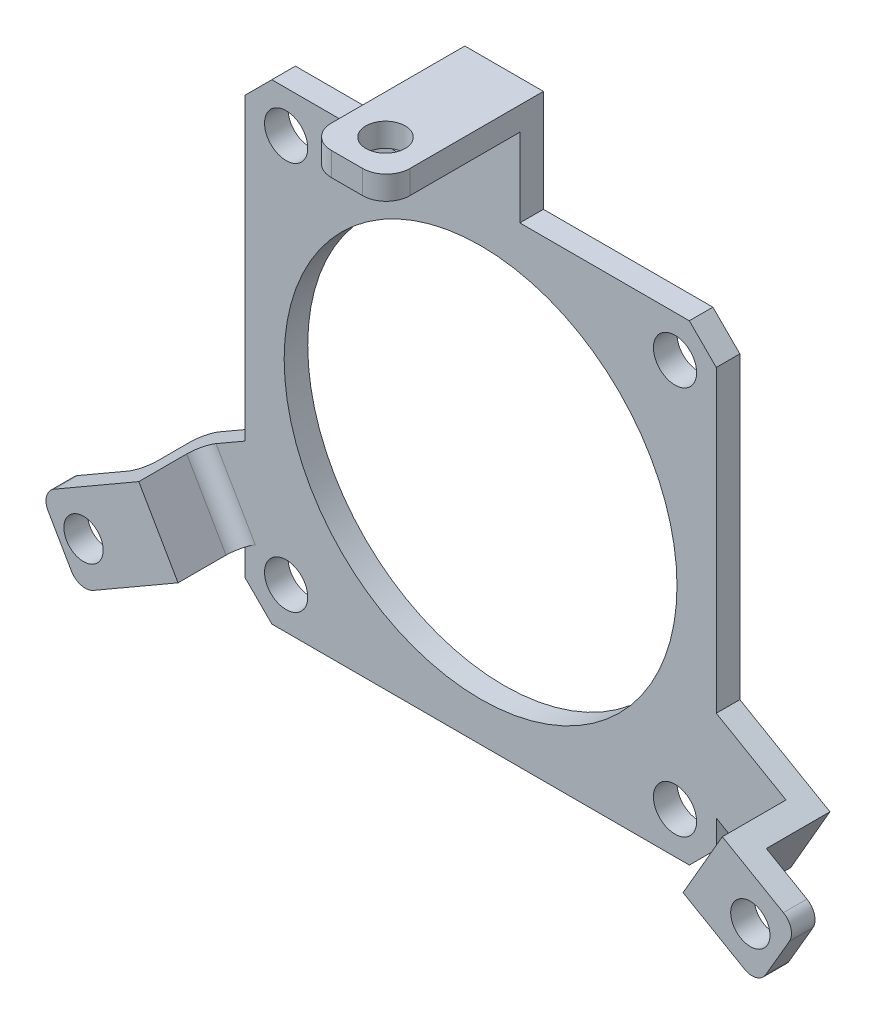
from build123d import *

# Parameters (mm, degrees)
SKETCH1_R           = 2.75
SKETCH1_R_2         = 25
SKETCH1_W           = 10
SKETCH1_H           = 11
SKETCH1_H_2         = 2
BOSS_EXTRUDE1_DEPTH = 2
SKETCH5_W           = 10
SKETCH5_H           = 3
BOSS_EXTRUDE2_DEPTH = 9.1
BOSS_EXTRUDE5_DEPTH = 3
SKETCH5_2_W         = 10
SKETCH5_2_H         = 3
BOSS_EXTRUDE6_DEPTH = 18
SKETCH7_R           = 2.5
CUT_EXTRUDE1_DEPTH  = 10
SKETCH1_4_R         = 2.75
SKETCH1_4_R_2       = 25
BOSS_EXTRUDE7_DEPTH = 3
SKETCH1_5_W         = 10
SKETCH1_5_H         = 11
BOSS_EXTRUDE8_DEPTH = 3
FILLET5_R           = 2
SKETCH10_R          = 2.5
CUT_EXTRUDE2_DEPTH  = 4
FILLET6_R           = 3
FILLET7_START       = -5
FILLET7_DEPTH       = 10
FILLET7_2_DEPTH     = 10


with BuildPart() as part:
    # Sketch1 → Boss-Extrude1 (new body)
    # profile 1 of 7: a face of its own
    with BuildSketch(Plane.XY):
        Polygon((26.568542495, 30), (-26.568542495, 30), (-30, 26.568542495), (-30, -26.568542495), (-26.568542495, -30), (26.568542495, -30), (30, -26.568542495), (30, 26.568542495), align=None)
        with Locations((-24.748737342, -24.748737342)):
            Circle(SKETCH1_R, mode=Mode.SUBTRACT)
        with Locations((24.748737342, -24.748737342)):
            Circle(SKETCH1_R, mode=Mode.SUBTRACT)
        with Locations((24.748737342, 24.748737342)):
            Circle(SKETCH1_R, mode=Mode.SUBTRACT)
        with Locations((-24.748737342, 24.748737342)):
            Circle(SKETCH1_R, mode=Mode.SUBTRACT)
        Circle(SKETCH1_R_2, mode=Mode.SUBTRACT)
    # profile 2 of 7: a face of its own
    with BuildSketch(Plane.XY):
        Polygon((-30, -23.094010768), (-30, -11.547005384), (-36.267949192, -15.165807537), (-31.267949192, -23.826061575), align=None)
    # profile 3 of 7: a face of its own
    with BuildSketch(Plane.XY):
        with Locations((0, 35.5)):
            Rectangle(SKETCH1_W, SKETCH1_H)
    # profile 4 of 7: a face of its own
    with BuildSketch(Plane.XY):
        Polygon((39.739092363, -17.169872981), (30, -11.547005384), (30, -23.094010768), (34.739092363, -25.830127019), align=None)
    # profile 5 of 7: a face of its own
    with BuildSketch(Plane.XY):
        Polygon((41.47114317, -18.169872981), (39.739092363, -17.169872981), (34.739092363, -25.830127019), (36.47114317, -26.830127019), align=None)
    # profile 6 of 7: a face of its own
    with BuildSketch(Plane.XY):
        with Locations((0, 42)):
            Rectangle(SKETCH1_W, SKETCH1_H_2)
    # profile 7 of 7: a face of its own
    with BuildSketch(Plane.XY):
        Polygon((-31.267949192, -23.826061575), (-36.267949192, -15.165807537), (-38, -16.165807537), (-33, -24.826061575), align=None)
    extrude(amount=BOSS_EXTRUDE1_DEPTH)

    # Sketch5 → Boss-Extrude2 (add)
    with BuildSketch(Plane.XY.offset(2)):
        with Locations((0, 41.5)):
            Rectangle(SKETCH5_W, SKETCH5_H)
        Polygon((-38, -16.165807537), (-35.401923789, -14.665807537), (-30.401923789, -23.326061575), (-33, -24.826061575), align=None)
        Polygon((41.47114317, -18.169872981), (38.873066959, -16.669872981), (33.873066959, -25.330127019), (36.47114317, -26.830127019), align=None)
    extrude(amount=BOSS_EXTRUDE2_DEPTH)

    # Sketch6 → Boss-Extrude5 (add)
    with BuildSketch(Plane.XY.offset(11.1)):
        with BuildLine():
            Line((-46.185292351, -20.891588279), (-35.401923789, -14.665807537))
            Line((-35.401923789, -14.665807537), (-30.401923789, -23.326061575))
            Line((-30.401923789, -23.326061575), (-41.185292351, -29.551842317))
            ThreePointArc((-41.185292351, -29.551842317), (-42.739686509, -29.75648219), (-43.983511401, -28.802061782))
            Line((-43.983511401, -28.802061782), (-46.935072886, -23.68980733))
            ThreePointArc((-46.935072886, -23.68980733), (-47.139712759, -22.135413172), (-46.185292351, -20.891588279))
        make_face()
        with BuildLine():
            Line((38.897920412, -16.684222129), (33.873066959, -25.330127019))
            Line((33.873066959, -25.330127019), (41.664082648, -29.84192454))
            ThreePointArc((41.664082648, -29.84192454), (43.179952831, -30.044118571), (44.395530273, -29.116155036))
            Line((44.395530273, -29.116155036), (47.391974814, -23.960387856))
            ThreePointArc((47.391974814, -23.960387856), (47.600320032, -22.403746576), (46.645140907, -21.157081967))
            Line((46.645140907, -21.157081967), (38.897920412, -16.684222129))
        make_face()
    extrude(amount=-BOSS_EXTRUDE5_DEPTH)

    # Sketch5<2> → Boss-Extrude6 (add)
    with BuildSketch(Plane.XY.offset(2)):
        with Locations((0, 41.5)):
            Rectangle(SKETCH5_2_W, SKETCH5_2_H)
    extrude(amount=BOSS_EXTRUDE6_DEPTH)

    # Sketch7 → Cut-Extrude1 (cut)
    with BuildSketch(Plane(origin=(0, 43, 0), x_dir=(1, 0, 0), z_dir=(0, 1, 0))):
        with Locations(Location((0, -15.1, 0), (0, 0, 270))):
            Circle(SKETCH7_R)
    extrude(amount=-CUT_EXTRUDE1_DEPTH, mode=Mode.SUBTRACT)

    # Sketch1<4> → Boss-Extrude7 (add)
    with BuildSketch(Plane.XY):
        Polygon((26.568542495, 30), (-26.568542495, 30), (-30, 26.568542495), (-30, -26.568542495), (-26.568542495, -30), (26.568542495, -30), (30, -26.568542495), (30, 26.568542495), align=None)
        with Locations((-24.748737342, -24.748737342)):
            Circle(SKETCH1_4_R, mode=Mode.SUBTRACT)
        with Locations((24.748737342, -24.748737342)):
            Circle(SKETCH1_4_R, mode=Mode.SUBTRACT)
        with Locations((24.748737342, 24.748737342)):
            Circle(SKETCH1_4_R, mode=Mode.SUBTRACT)
        with Locations((-24.748737342, 24.748737342)):
            Circle(SKETCH1_4_R, mode=Mode.SUBTRACT)
        Circle(SKETCH1_4_R_2, mode=Mode.SUBTRACT)
    extrude(amount=BOSS_EXTRUDE7_DEPTH)

    # Sketch1<5> → Boss-Extrude8 (add)
    with BuildSketch(Plane.XY):
        with Locations((0, 35.5)):
            Rectangle(SKETCH1_5_W, SKETCH1_5_H)
        Polygon((-30, -23.094010768), (-30, -11.547005384), (-36.267949192, -15.165807537), (-31.267949192, -23.826061575), align=None)
        Polygon((39.739092363, -17.169872981), (30, -11.547005384), (30, -23.094010768), (34.739092363, -25.830127019), align=None)
    extrude(amount=BOSS_EXTRUDE8_DEPTH)

    # Fillet5
    fillet5_edges = [part.edges().sort_by_distance(p)[0] for p in [
        (-35.5, -20.495934556, 8.1),
    ]]
    fillet(fillet5_edges, radius=FILLET5_R)

    # Sketch10 → Cut-Extrude2 (cut)
    with BuildSketch(Plane.XY.offset(11.1)):
        with Locations((42.435244785, -24.5)):
            Circle(SKETCH10_R)
        with Locations((-42.435244785, -24.5)):
            Circle(SKETCH10_R)
    extrude(amount=-CUT_EXTRUDE2_DEPTH, mode=Mode.SUBTRACT)

    # Fillet6
    fillet6_edges = [part.edges().sort_by_distance(p)[0] for p in [
        (-5, 41.5, 20),
        (5, 41.5, 20),
    ]]
    fillet(fillet6_edges, radius=FILLET6_R)

    # Fillet7: read off the stored shape, not the designer's step
    # Fillet7 outline → Fillet7 (cut)
    with BuildSketch(Plane(origin=(0, 0, 0), x_dir=(0.8660254037844398, 0.499999999999998, 0), z_dir=(0.49999999999999795, -0.8660254037844399, 0)).offset(FILLET7_START)):
        with BuildLine():
            ThreePointArc((-38.991869112, 0), (-40.406082675, 0.585786438), (-40.991869112, 2))
            Line((-40.991869112, 2), (-40.991869112, 0))
            Line((-40.991869112, 0), (-38.991869112, 0))
        make_face()
    extrude(amount=FILLET7_DEPTH, mode=Mode.SUBTRACT)

    # Fillet7 2 outline → Fillet7 2 (add)
    with BuildSketch(Plane(origin=(0, 0, 0), x_dir=(0.8660254037844398, 0.499999999999998, 0), z_dir=(0.49999999999999795, -0.8660254037844399, 0)).offset(FILLET7_START)):
        with BuildLine():
            Line((-37.991869112, 3), (-35.991869112, 3))
            ThreePointArc((-35.991869112, 3), (-37.406082675, 3.585786438), (-37.991869112, 5))
            Line((-37.991869112, 5), (-37.991869112, 3))
        make_face()
    extrude(amount=FILLET7_2_DEPTH)


solid = part.part
